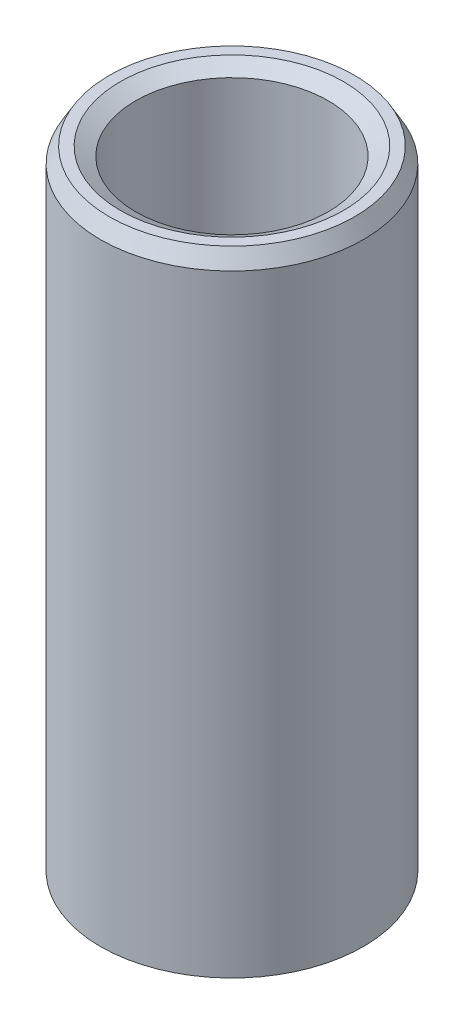
from build123d import *
from OCP.BRepFilletAPI import BRepFilletAPI_MakeChamfer

# Parameters (mm, degrees)
SKETCH1_R           = 27.5
BOSS_EXTRUDE1_DEPTH = 133.156342285
SKETCH2_R           = 20.144239437
CUT_EXTRUDE1_DEPTH  = 139.71954257
CHAMFER1_SIZE       = 3.208487056
CHAMFER1_SIZE2      = 1.852420866


with BuildPart() as part:
    # Sketch1 → Boss-Extrude1 (new body)
    with BuildSketch(Plane(origin=(0, 0, 0), x_dir=(1, 0, 0), z_dir=(0, 1, 0))):
        Circle(SKETCH1_R)
    extrude(amount=BOSS_EXTRUDE1_DEPTH)

    # Sketch2 → Cut-Extrude1 (cut, through all)
    with BuildSketch(Plane(origin=(0, 0, 0), x_dir=(1, 0, 0), z_dir=(0, 1, 0))):
        Circle(SKETCH2_R)
    extrude(amount=CUT_EXTRUDE1_DEPTH, mode=Mode.SUBTRACT)

    # Chamfer1: one chamfer whose edges measure the first distance from different faces: ONE call of the kernel's chamfer builder (chamfer() names one face for all edges)
    chamfer1_edges_1 = [part.edges().sort_by_distance(p)[0] for p in [
        (-20.144239437, 133.156342285, 0),
    ]]
    chamfer1_side_1 = [part.faces().sort_by_distance(p)[0] for p in [
        (-26.722182541, 133.156342285, 0),
    ]]
    chamfer1_edges_2 = [part.edges().sort_by_distance(p)[0] for p in [
        (-20.144239437, 0, 0),
    ]]
    chamfer1_side_2 = [part.faces().sort_by_distance(p)[0] for p in [
        (-20.144239437, 66.578171143, 0),
    ]]
    chamfer1_edges_3 = [part.edges().sort_by_distance(p)[0] for p in [
        (-27.5, 0, 0),
    ]]
    chamfer1_side_3 = [part.faces().sort_by_distance(p)[0] for p in [
        (-26.722182541, 0, 0),
    ]]
    chamfer1_edges_4 = [part.edges().sort_by_distance(p)[0] for p in [
        (-27.5, 133.156342285, 0),
    ]]
    chamfer1_side_4 = [part.faces().sort_by_distance(p)[0] for p in [
        (-27.5, 66.578171143, 0),
    ]]
    chamfer1 = BRepFilletAPI_MakeChamfer(part.part.solid().wrapped)
    for e in chamfer1_edges_1:
        chamfer1.Add(CHAMFER1_SIZE, CHAMFER1_SIZE2, e.wrapped, chamfer1_side_1[0].wrapped)  # the first distance lies on this face
    for e in chamfer1_edges_2:
        chamfer1.Add(CHAMFER1_SIZE, CHAMFER1_SIZE2, e.wrapped, chamfer1_side_2[0].wrapped)  # the first distance lies on this face
    for e in chamfer1_edges_3:
        chamfer1.Add(CHAMFER1_SIZE, CHAMFER1_SIZE2, e.wrapped, chamfer1_side_3[0].wrapped)  # the first distance lies on this face
    for e in chamfer1_edges_4:
        chamfer1.Add(CHAMFER1_SIZE, CHAMFER1_SIZE2, e.wrapped, chamfer1_side_4[0].wrapped)  # the first distance lies on this face
    add(Compound.cast(chamfer1.Shape()), mode=Mode.REPLACE)


solid = part.part
